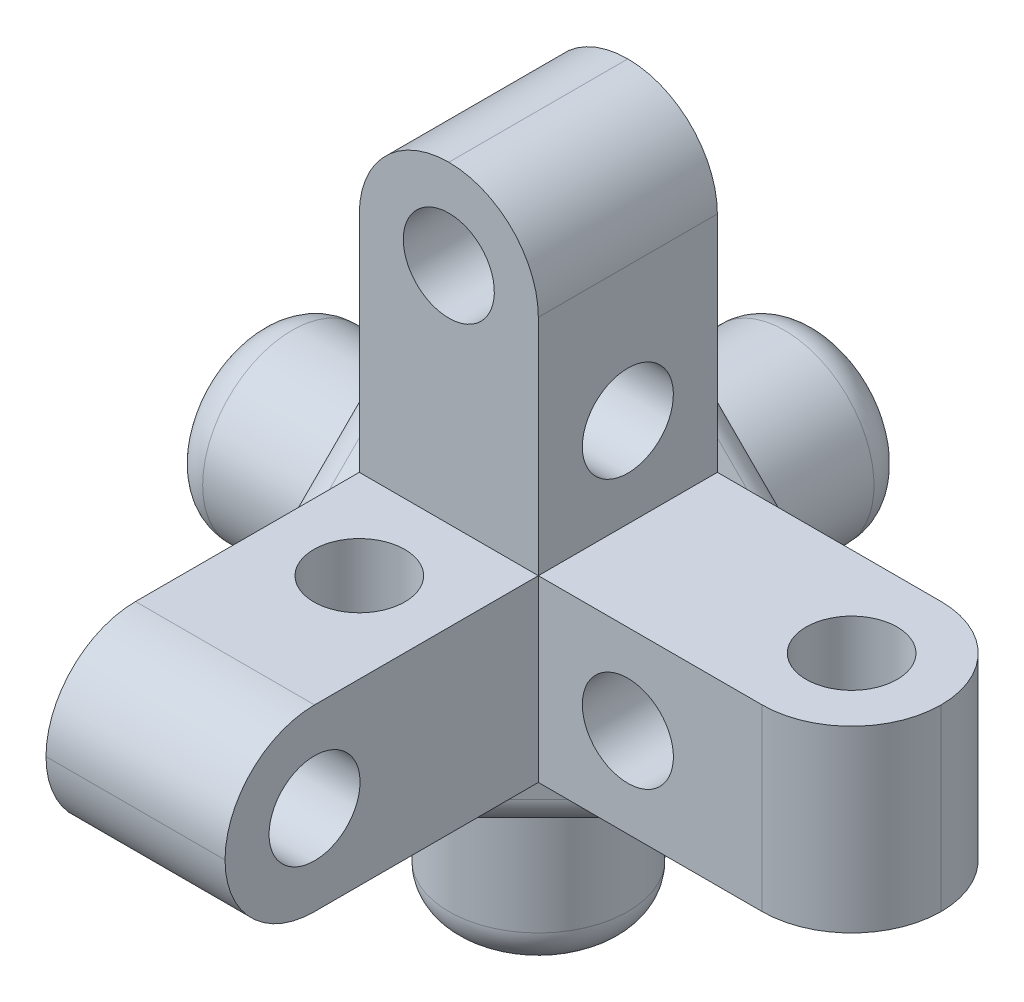
from build123d import *

# Parameters (mm, degrees)
SKETCH1_W                = 33
SKETCH1_H                = 33
BOSS_EXTRUDE1_DEPTH      = 33
SKETCH2_W                = 21
SKETCH2_H                = 21
CUT_EXTRUDE1_DEPTH       = 58.15767665
SKETCH3_W                = 21
SKETCH3_H                = 21
CUT_EXTRUDE2_DEPTH       = 58.15767665
SKETCH4_W                = 21
SKETCH4_H                = 21
CUT_EXTRUDE3_DEPTH       = 58.15767665
SKETCH5_R                = 3.05
CUT_EXTRUDE4_DEPTH       = 58.15767665
SKETCH6_R                = 3.05
CUT_EXTRUDE5_DEPTH       = 58.15767665
SKETCH7_R                = 3.05
CUT_EXTRUDE6_DEPTH       = 58.15767665
FILLET1_R                = 6
CHAMFER1_START           = -1
CHAMFER1_OUTLINE_W       = 16
CHAMFER1_OUTLINE_H       = 18
CHAMFER1_DEPTH           = 6.773502692
BOSS_EXTRUDE3_DEPTH      = 8
BOSS_EXTRUDE3_DEPTH_BACK = 10
SKETCH9_W                = 18
SKETCH9_H                = 18
CHAMFER2_SIZE            = 6
FILLET2_R                = 1.25
SKETCH10_R               = 6
BOSS_EXTRUDE4_DEPTH      = 10
SKETCH11_R               = 6
BOSS_EXTRUDE5_DEPTH      = 10
SKETCH12_R               = 6
BOSS_EXTRUDE6_DEPTH      = 10
FILLET3_R                = 2
FILLET4_R                = 2.5


with BuildPart() as part:
    # Sketch1 → Boss-Extrude1 (new body)
    with BuildSketch(Plane(origin=(0, 0, 0), x_dir=(1, 0, 0), z_dir=(0, 1, 0))):
        with Locations((16.5, -16.5)):
            Rectangle(SKETCH1_W, SKETCH1_H)
    extrude(amount=BOSS_EXTRUDE1_DEPTH)

    # Sketch2 → Cut-Extrude1 (cut, through all)
    with BuildSketch(Plane.XY.offset(33)):
        with Locations((22.5, 22.5)):
            Rectangle(SKETCH2_W, SKETCH2_H)
    extrude(amount=-CUT_EXTRUDE1_DEPTH, mode=Mode.SUBTRACT)

    # Sketch3 → Cut-Extrude2 (cut, through all)
    with BuildSketch(Plane.XZ):
        with Locations((22.5, 22.5)):
            Rectangle(SKETCH3_W, SKETCH3_H)
    extrude(amount=-CUT_EXTRUDE2_DEPTH, mode=Mode.SUBTRACT)

    # Sketch4 → Cut-Extrude3 (cut, through all)
    with BuildSketch(Plane.ZY):
        with Locations((22.5, 22.5)):
            Rectangle(SKETCH4_W, SKETCH4_H)
    extrude(amount=-CUT_EXTRUDE3_DEPTH, mode=Mode.SUBTRACT)

    # Sketch5 → Cut-Extrude4 (cut, through all)
    with BuildSketch(Plane.ZY):
        with Locations((27, 6)):
            Circle(SKETCH5_R)
        with Locations((6, 18)):
            Circle(SKETCH5_R)
    extrude(amount=-CUT_EXTRUDE4_DEPTH, mode=Mode.SUBTRACT)

    # Sketch6 → Cut-Extrude5 (cut, through all)
    with BuildSketch(Plane.XZ):
        with Locations(Location((6, 18, 0), (0, 0, 270))):
            Circle(SKETCH6_R)
        with Locations(Location((27, 6, 0), (0, 0, 270))):
            Circle(SKETCH6_R)
    extrude(amount=-CUT_EXTRUDE5_DEPTH, mode=Mode.SUBTRACT)

    # Sketch7 → Cut-Extrude6 (cut, through all)
    with BuildSketch(Plane(origin=(0, 0, 0), x_dir=(-1, 0, 0), z_dir=(0, 0, -1))):
        with Locations((-18, 6)):
            Circle(SKETCH7_R)
        with Locations((-6, 27)):
            Circle(SKETCH7_R)
    extrude(amount=-CUT_EXTRUDE6_DEPTH, mode=Mode.SUBTRACT)

    # Fillet1
    fillet1_edges = [part.edges().sort_by_distance(p)[0] for p in [
        (12, 33, 6),
        (0, 33, 6),
        (6, 12, 33),
        (6, 0, 33),
        (33, 6, 0),
        (33, 6, 12),
    ]]
    fillet(fillet1_edges, radius=FILLET1_R - 0.0001)  # a hair under: the kernel refuses the full size

    # Chamfer1: read off the stored shape, not the designer's step
    # Chamfer1 outline → Chamfer1 (cut)
    with BuildSketch(Plane(origin=(0, 0, 0), x_dir=(0.8164965809277258, -0.40824829046386313, -0.40824829046386313), z_dir=(0.5773502691896258, 0.5773502691896258, 0.5773502691896258)).offset(CHAMFER1_START)):
        with Locations((2, 0)):
            Rectangle(CHAMFER1_OUTLINE_W, CHAMFER1_OUTLINE_H)
    extrude(amount=CHAMFER1_DEPTH, mode=Mode.SUBTRACT)

    # Sketch9 → Boss-Extrude3 (add, two sides: drawn at the far end of the back side and taken through both)
    with BuildSketch(Plane(origin=(0, 0, 0), x_dir=(1, 0, 0), z_dir=(0, 1, 0)).offset(-BOSS_EXTRUDE3_DEPTH_BACK)):
        with Locations((-1, 1)):
            Rectangle(SKETCH9_W, SKETCH9_H)
    extrude(amount=BOSS_EXTRUDE3_DEPTH + BOSS_EXTRUDE3_DEPTH_BACK)

    # Chamfer2
    chamfer2_edges = [part.edges().sort_by_distance(p)[0] for p in [
        (8, -5, 8),
        (8, 8, -5),
        (-5, 8, 8),
    ]]
    chamfer(chamfer2_edges, length=CHAMFER2_SIZE)

    # Fillet2
    # the kernel refuses this fillet: 1.25 mm, written as the material it adds along each edge
    with BuildSketch(Plane(origin=(-4.268829387, 8, 6.268829387), x_dir=(-0.408248290463863, 0.816496580927726, -0.408248290463863), z_dir=(0.7071067811865476, 0, -0.7071067811865476))) as fillet2_piece_1_section:
        with BuildLine():
            CenterArc((FILLET2_R * 1.93185165258, -FILLET2_R), FILLET2_R, 90, 125.264389683)
            Line((FILLET2_R * 1.11535507165, -FILLET2_R * 1.57735026919), (0, 0))
            Line((0, 0), (FILLET2_R * 1.93185165258, 0))
        make_face()
    fillet2_piece_1 = extrude(amount=14.902499954, mode=Mode.PRIVATE)
    fillet2_piece_1 = split(fillet2_piece_1, bisect_by=Plane(origin=(-1.134414693, 11.134414693, 6.268829387), z_dir=(-0.7071067811865476, -0.7071067811865476, 0)), keep=Keep.TOP, mode=Mode.PRIVATE)
    fillet2_piece_1 = split(fillet2_piece_1, bisect_by=Plane(origin=(-4.268829387, 5.865585306, 4.134414694), z_dir=(0, -0.7071067811865476, -0.7071067811865476)), keep=Keep.TOP, mode=Mode.PRIVATE)
    add(fillet2_piece_1)
    with BuildSketch(Plane(origin=(-4.268829387, 6.268829387, 8), x_dir=(-0.4082482904638628, -0.4082482904638628, 0.8164965809277263), z_dir=(0.7071067811865476, -0.7071067811865476, 0))) as fillet2_piece_2_section:
        with BuildLine():
            CenterArc((FILLET2_R * 1.93185165258, FILLET2_R), FILLET2_R, 144.735610317, 125.264389683)
            Line((FILLET2_R * 1.11535507165, FILLET2_R * 1.57735026919), (0, 0))
            Line((0, 0), (FILLET2_R * 1.93185165258, 0))
        make_face()
    fillet2_piece_2 = extrude(amount=14.902499954, mode=Mode.PRIVATE)
    fillet2_piece_2 = split(fillet2_piece_2, bisect_by=Plane(origin=(-4.268829387, 4.134414694, 5.865585306), z_dir=(0, -0.7071067811865476, -0.7071067811865476)), keep=Keep.TOP, mode=Mode.PRIVATE)
    fillet2_piece_2 = split(fillet2_piece_2, bisect_by=Plane(origin=(-1.134414693, 6.268829387, 11.134414693), z_dir=(-0.7071067811865476, 0, -0.7071067811865475)), keep=Keep.TOP, mode=Mode.PRIVATE)
    add(fillet2_piece_2)
    with BuildSketch(Plane(origin=(8, -4.268829387, 6.268829387), x_dir=(0.8164965809277257, -0.40824829046386313, -0.4082482904638633), z_dir=(0, 0.7071067811865476, -0.7071067811865475))) as fillet2_piece_3_section:
        with BuildLine():
            CenterArc((FILLET2_R * 1.93185165258, FILLET2_R), FILLET2_R, 144.735610317, 125.264389683)
            Line((FILLET2_R * 1.11535507165, FILLET2_R * 1.57735026919), (0, 0))
            Line((0, 0), (FILLET2_R * 1.93185165258, 0))
        make_face()
    fillet2_piece_3 = extrude(amount=14.902499954, mode=Mode.PRIVATE)
    fillet2_piece_3 = split(fillet2_piece_3, bisect_by=Plane(origin=(11.134414693, -1.134414693, 6.268829387), z_dir=(-0.7071067811865476, -0.7071067811865476, 0)), keep=Keep.TOP, mode=Mode.PRIVATE)
    fillet2_piece_3 = split(fillet2_piece_3, bisect_by=Plane(origin=(5.865585306, -4.268829387, 4.134414694), z_dir=(-0.7071067811865476, 0, -0.7071067811865475)), keep=Keep.TOP, mode=Mode.PRIVATE)
    add(fillet2_piece_3)

    # Sketch10 → Boss-Extrude4 (add)
    with BuildSketch(Plane.XZ.offset(10)):
        with Locations(Location((-1, -1, 0), (0, 0, 270))):
            Circle(SKETCH10_R)
    extrude(amount=BOSS_EXTRUDE4_DEPTH)

    # Sketch11 → Boss-Extrude5 (add)
    with BuildSketch(Plane.ZY.offset(10)):
        with Locations((-1, -1)):
            Circle(SKETCH11_R)
    extrude(amount=BOSS_EXTRUDE5_DEPTH)

    # Sketch12 → Boss-Extrude6 (add)
    with BuildSketch(Plane(origin=(0, 0, -10), x_dir=(-1, 0, 0), z_dir=(0, 0, -1))):
        with Locations((1, -1)):
            Circle(SKETCH12_R)
    extrude(amount=BOSS_EXTRUDE6_DEPTH)

    # Fillet3
    fillet3_edges = [part.edges().sort_by_distance(p)[0] for p in [
        (8, -4, -10),
        (-4, -10, 8),
        (-10, 8, -4),
        (-10, -1, -10),
        (-4, 8, -10),
        (-10, -4, 8),
        (-10, -10, -1),
        (-1, -10, -10),
        (8, -10, -4),
        (5, -10, 5),
        (5, 5, -10),
        (-10, 5, 5),
    ]]
    fillet(fillet3_edges, radius=FILLET3_R)

    # Fillet4
    fillet4_edges = [part.edges().sort_by_distance(p)[0] for p in [
        (-1, -20, 5),
        (-20, -1, -7),
        (5, -1, -20),
    ]]
    fillet(fillet4_edges, radius=FILLET4_R)


solid = part.part
